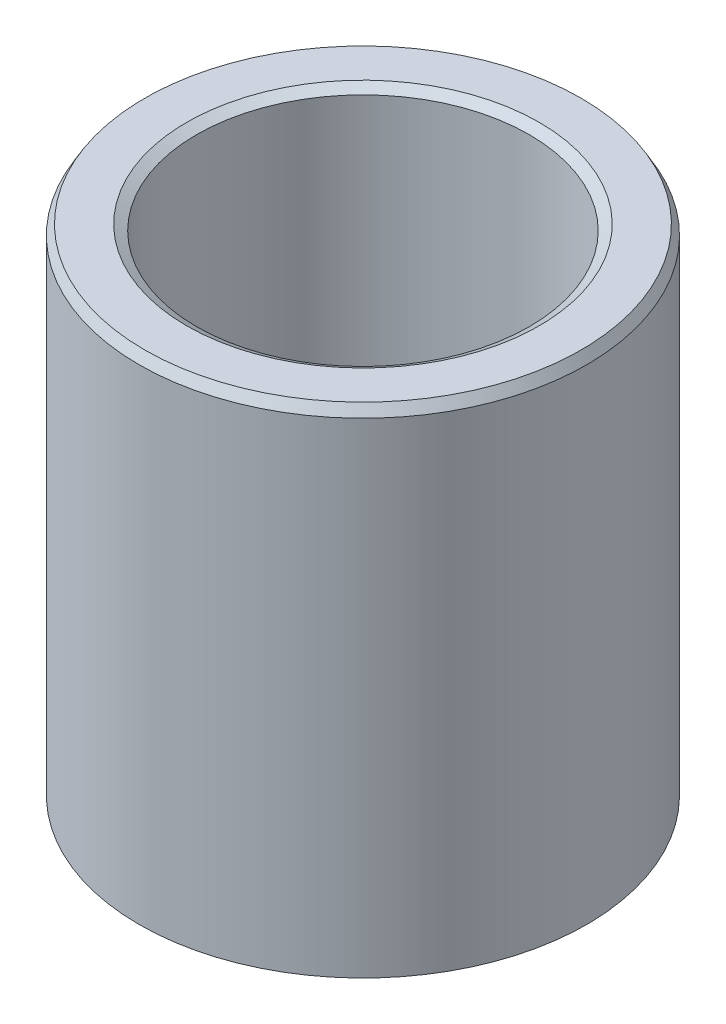
from build123d import *
from OCP.BRepFilletAPI import BRepFilletAPI_MakeChamfer

# Parameters (mm, degrees)
SKETCH1_R           = 22.5
BOSS_EXTRUDE1_DEPTH = 50.297199166
SKETCH2_R           = 16.721651433
CUT_EXTRUDE1_DEPTH  = 60.517293654
CHAMFER1_SIZE       = 0.995127292
CHAMFER1_SIZE2      = 0.57453701


with BuildPart() as part:
    # Sketch1 → Boss-Extrude1 (new body)
    with BuildSketch(Plane(origin=(0, 0, 0), x_dir=(1, 0, 0), z_dir=(0, 1, 0))):
        Circle(SKETCH1_R)
    extrude(amount=BOSS_EXTRUDE1_DEPTH)

    # Sketch2 → Cut-Extrude1 (cut, through all)
    with BuildSketch(Plane(origin=(0, 0, 0), x_dir=(1, 0, 0), z_dir=(0, 1, 0))):
        Circle(SKETCH2_R)
    extrude(amount=CUT_EXTRUDE1_DEPTH, mode=Mode.SUBTRACT)

    # Chamfer1: one chamfer whose edges measure the first distance from different faces: ONE call of the kernel's chamfer builder (chamfer() names one face for all edges)
    chamfer1_edges_1 = [part.edges().sort_by_distance(p)[0] for p in [
        (-16.721651433, 50.297199166, 0),
    ]]
    chamfer1_side_1 = [part.faces().sort_by_distance(p)[0] for p in [
        (-21.863603897, 50.297199166, 0),
    ]]
    chamfer1_edges_2 = [part.edges().sort_by_distance(p)[0] for p in [
        (-16.721651433, 0, 0),
    ]]
    chamfer1_side_2 = [part.faces().sort_by_distance(p)[0] for p in [
        (-16.721651433, 25.148599583, 0),
    ]]
    chamfer1_edges_3 = [part.edges().sort_by_distance(p)[0] for p in [
        (-22.5, 0, 0),
    ]]
    chamfer1_side_3 = [part.faces().sort_by_distance(p)[0] for p in [
        (-21.863603897, 0, 0),
    ]]
    chamfer1_edges_4 = [part.edges().sort_by_distance(p)[0] for p in [
        (-22.5, 50.297199166, 0),
    ]]
    chamfer1_side_4 = [part.faces().sort_by_distance(p)[0] for p in [
        (-22.5, 25.148599583, 0),
    ]]
    chamfer1 = BRepFilletAPI_MakeChamfer(part.part.solid().wrapped)
    for e in chamfer1_edges_1:
        chamfer1.Add(CHAMFER1_SIZE, CHAMFER1_SIZE2, e.wrapped, chamfer1_side_1[0].wrapped)  # the first distance lies on this face
    for e in chamfer1_edges_2:
        chamfer1.Add(CHAMFER1_SIZE, CHAMFER1_SIZE2, e.wrapped, chamfer1_side_2[0].wrapped)  # the first distance lies on this face
    for e in chamfer1_edges_3:
        chamfer1.Add(CHAMFER1_SIZE, CHAMFER1_SIZE2, e.wrapped, chamfer1_side_3[0].wrapped)  # the first distance lies on this face
    for e in chamfer1_edges_4:
        chamfer1.Add(CHAMFER1_SIZE, CHAMFER1_SIZE2, e.wrapped, chamfer1_side_4[0].wrapped)  # the first distance lies on this face
    add(Compound.cast(chamfer1.Shape()), mode=Mode.REPLACE)


solid = part.part
